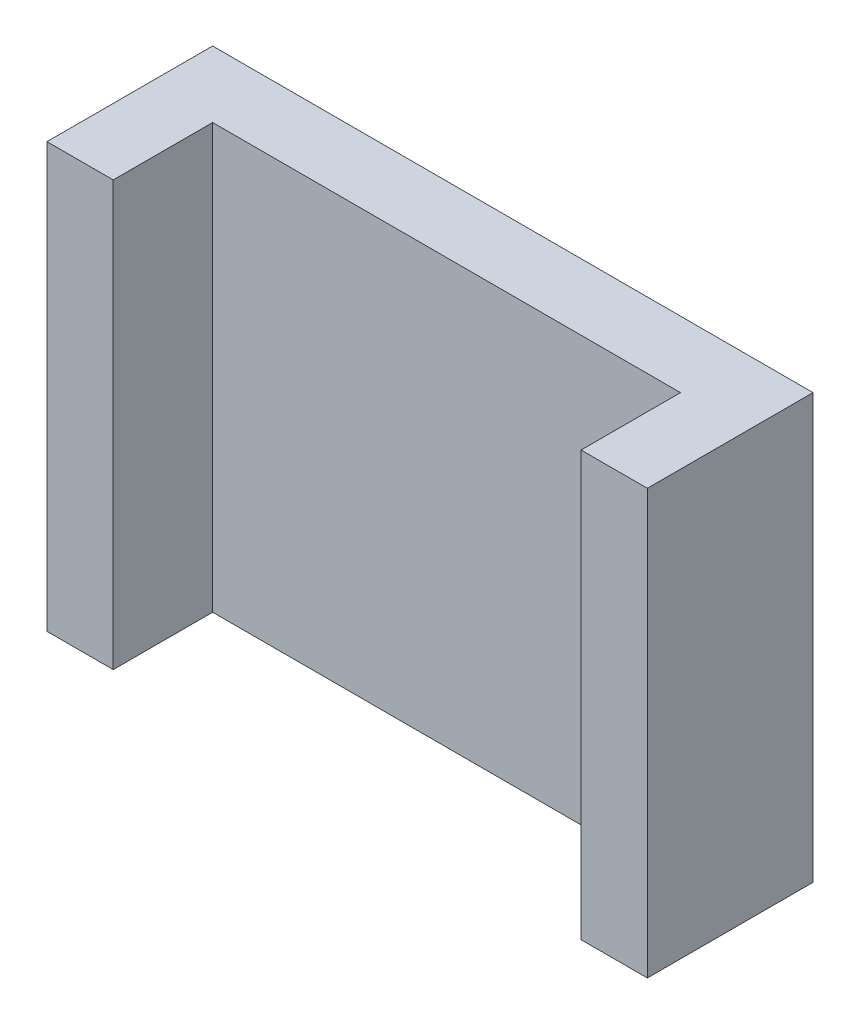
from build123d import *

# Parameters (mm, degrees)
SKETCH1_W           = 45.3
SKETCH1_H           = 32
BOSS_EXTRUDE1_DEPTH = 5
SKETCH2_W           = 5
SKETCH2_H           = 32
BOSS_EXTRUDE2_DEPTH = 7.5


with BuildPart() as part:
    # Sketch1 → Boss-Extrude1 (new body)
    with BuildSketch(Plane.XY):
        with Locations((22.65, 16)):
            Rectangle(SKETCH1_W, SKETCH1_H)
    extrude(amount=BOSS_EXTRUDE1_DEPTH)

    # Sketch2 → Boss-Extrude2 (add)
    with BuildSketch(Plane.XY.offset(5)):
        with Locations((2.5, 16)):
            Rectangle(SKETCH2_W, SKETCH2_H)
        with Locations((42.8, 16)):
            Rectangle(SKETCH2_W, SKETCH2_H)
    extrude(amount=BOSS_EXTRUDE2_DEPTH)


solid = part.part
